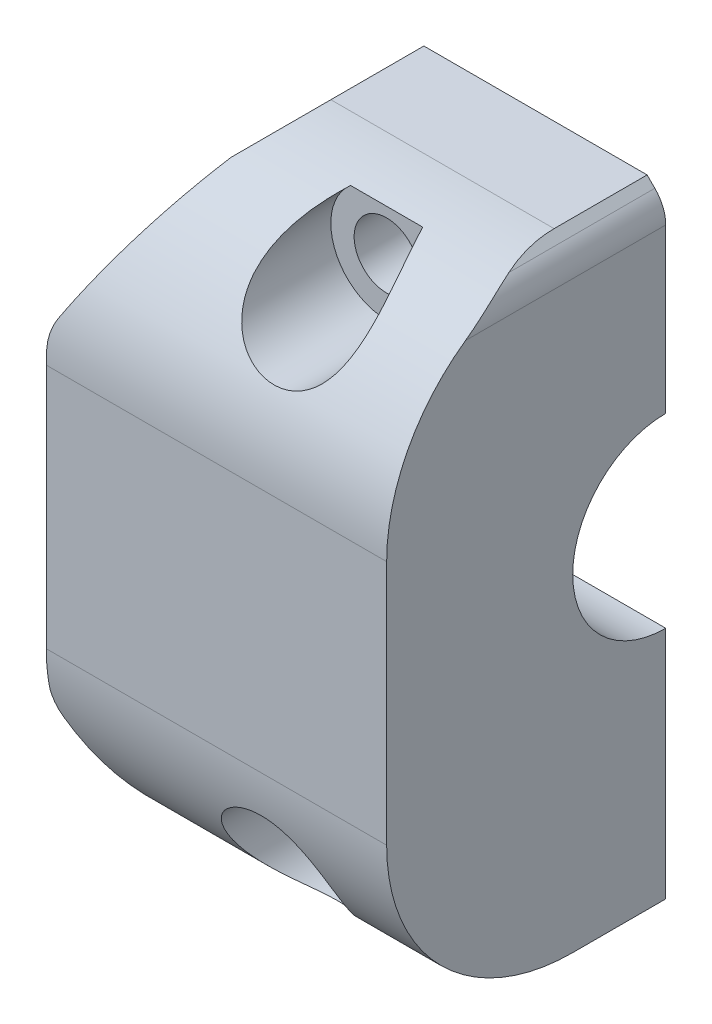
from build123d import *

# Parameters (mm, degrees)
BOSS_EXTRUDE1_DEPTH = 15
SKETCH3_R           = 5
CUT_EXTRUDE1_DEPTH  = 30.486936791
SKETCH5_R           = 1.75
CUT_EXTRUDE3_DEPTH  = 131.953306572
CUT_EXTRUDE4_START  = -8
SKETCH6_R           = 3
CUT_EXTRUDE4_DEPTH  = 123.953306572
FILLET1_START       = -130
FILLET1_DEPTH       = 19.4


with BuildPart() as part:
    # Sketch1 → Boss-Extrude1 (new body)
    with BuildSketch(Plane.XY):
        with BuildLine():
            Line((-124.6, 14.6), (-128.493415545, 7.856406461))
            ThreePointArc((-128.493415545, 7.856406461), (-128.793116813, 7.132863596), (-128.895339334, 6.356406461))
            Line((-128.895339334, 6.356406461), (-128.895339334, -9.356406461))
            ThreePointArc((-128.895339334, -9.356406461), (-128.793116813, -10.132863596), (-128.493415545, -10.856406461))
            Line((-128.493415545, -10.856406461), (-124.6, -17.6))
            Line((-124.6, -17.6), (-110.6, -17.6))
            Line((-110.6, -17.6), (-110.6, -5))
            Line((-110.6, -5), (-110.6, 5))
            Line((-110.6, 5), (-110.6, 13.771572875))
            ThreePointArc((-110.6, 13.771572875), (-110.752240935, 14.53693974), (-111.185786438, 15.185786438))
            Line((-111.185786438, 15.185786438), (-111.6, 15.6))
            Line((-111.6, 15.6), (-123.6, 15.6))
            Line((-123.6, 15.6), (-124.6, 14.6))
        make_face()
    extrude(amount=BOSS_EXTRUDE1_DEPTH)

    # Sketch3 → Cut-Extrude1 (cut, through all)
    with BuildSketch(Plane(origin=(-110.6, 0, 0), x_dir=(0, 0, -1), z_dir=(1, 0, 0))):
        Circle(SKETCH3_R)
    extrude(amount=-CUT_EXTRUDE1_DEPTH, mode=Mode.SUBTRACT)

    # Sketch5 → Cut-Extrude3 (cut, through all)
    with BuildSketch(Plane(origin=(0, 0, 0), x_dir=(-1, 0, 0), z_dir=(0, 0, -1))):
        with Locations((117.6, 12.85)):
            Circle(SKETCH5_R)
        with Locations((117.6, -12.85)):
            Circle(SKETCH5_R)
    extrude(amount=-CUT_EXTRUDE3_DEPTH, mode=Mode.SUBTRACT)

    # Sketch6 → Cut-Extrude4 (cut, through all)
    with BuildSketch(Plane(origin=(0, 0, 0), x_dir=(-1, 0, 0), z_dir=(0, 0, -1)).offset(CUT_EXTRUDE4_START)):
        with Locations((117.6, 12.85)):
            Circle(SKETCH6_R)
        with Locations((117.6, -12.85)):
            Circle(SKETCH6_R)
    extrude(amount=-CUT_EXTRUDE4_DEPTH, mode=Mode.SUBTRACT)

    # Fillet1: read off the stored shape, not the designer's step
    # Fillet1 outline → Fillet1 (cut)
    with BuildSketch(Plane.YZ.offset(FILLET1_START)):
        with BuildLine():
            ThreePointArc((-17.6, 5), (-14.671067812, 12.071067812), (-7.6, 15))
            Line((-7.6, 15), (-17.6, 15))
            Line((-17.6, 15), (-17.6, 5))
        make_face()
        with BuildLine():
            ThreePointArc((5.6, 15), (12.671067812, 12.071067812), (15.6, 5))
            Line((15.6, 5), (15.6, 15))
            Line((15.6, 15), (5.6, 15))
        make_face()
    extrude(amount=FILLET1_DEPTH, mode=Mode.SUBTRACT)


solid = part.part
